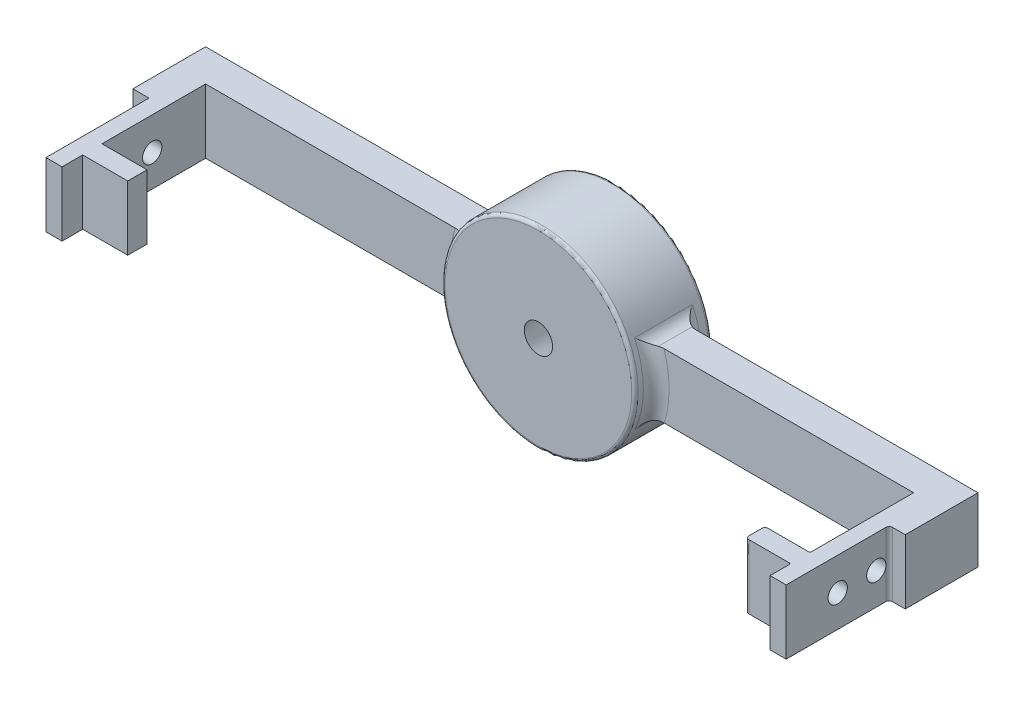
from build123d import *

# Parameters (mm, degrees)
SKETCH7_R            = 15
BOSS_EXTRUDE2_DEPTH  = 12
SKETCH8_R            = 2.2
CUT_EXTRUDE2_DEPTH   = 20
CUT_EXTRUDE2_DRAFT   = 20
BOSS_EXTRUDE4_START  = -3
SKETCH11_W           = 5
SKETCH11_H           = 10
BOSS_EXTRUDE4_DEPTH  = 48
SKETCH14_W           = 5
SKETCH14_H           = 10
BOSS_EXTRUDE5_DEPTH  = 6.3
SKETCH17_W           = 2.5
SKETCH17_H           = 10
BOSS_EXTRUDE8_DEPTH  = 16
SKETCH20_R           = 1.5
CUT_EXTRUDE3_DEPTH   = 15
FILLET2_R            = 2
FILLET7_R            = 0.5
FILLET8_R            = 0.5
SKETCH24_W           = 3
SKETCH24_H           = 10
BOSS_EXTRUDE11_DEPTH = 7
FILLET2_OF_MIRROR5_R = 2
FILLET9_R            = 0.2
FILLET10_START       = -6
FILLET10_DEPTH       = 12
FILLET10_START_2     = -4.929582237
FILLET10_2_DEPTH     = 10
FILLET11_R           = 0.5


with BuildPart() as part:
    # Sketch7 → Boss-Extrude2 (new body)
    with BuildSketch(Plane.XY.offset(37)):
        Circle(SKETCH7_R)
    extrude(amount=-BOSS_EXTRUDE2_DEPTH)


with BuildPart() as cut_extrude2_tool:
    # Sketch8 → Cut-Extrude2 (with draft: the straight prism first)
    with BuildSketch(Plane.XY.offset(37)):
        Circle(SKETCH8_R)
    extrude(amount=-CUT_EXTRUDE2_DEPTH)
    # Cut-Extrude2: the draft: its side faces are tilted about the plane it starts from
    cut_extrude2_sides = [cut_extrude2_tool.faces().sort_by_distance(p)[0] for p in [
        (-2.2, 0, 27),
    ]]
    draft(cut_extrude2_sides, Plane.XY.offset(37), CUT_EXTRUDE2_DRAFT)


with BuildPart() as part_1:
    add(part.part)

    # Cut-Extrude2: cut by cut_extrude2_tool
    add(cut_extrude2_tool.part, mode=Mode.SUBTRACT)

    # Sketch11 → Boss-Extrude4 (add)
    with BuildSketch(Plane(origin=(15, 0, 0), x_dir=(0, 0, -1), z_dir=(1, 0, 0)).offset(BOSS_EXTRUDE4_START)):
        with Locations((-31.203319291, 0.070417763)):
            Rectangle(SKETCH11_W, SKETCH11_H)
    boss_extrude4 = extrude(amount=BOSS_EXTRUDE4_DEPTH)

    # Sketch14 → Boss-Extrude5 (add)
    with BuildSketch(Plane.XY.offset(33.703319291)):
        with Locations((57.5, 0.070417763)):
            Rectangle(SKETCH14_W, SKETCH14_H)
    boss_extrude5 = extrude(amount=BOSS_EXTRUDE5_DEPTH)

    # Sketch17 → Boss-Extrude8 (add)
    with BuildSketch(Plane.XY.offset(40.003319291)):
        with Locations((56.25, 0.070417763)):
            Rectangle(SKETCH17_W, SKETCH17_H)
    boss_extrude8 = extrude(amount=BOSS_EXTRUDE8_DEPTH)

    # Sketch20 → Cut-Extrude3 (cut)
    with BuildSketch(Plane(origin=(57.5, 0, 0), x_dir=(0, 0, -1), z_dir=(1, 0, 0))):
        with Locations((-42.003319291, 0)):
            Circle(SKETCH20_R)
        with Locations((-48.003319291, 0)):
            Circle(SKETCH20_R)
    cut_extrude3 = extrude(amount=-CUT_EXTRUDE3_DEPTH, mode=Mode.SUBTRACT)

    # Fillet2
    fillet2_edges = [part_1.edges().sort_by_distance(p)[0] for p in [
        (14.166835178, -4.929582237, 31.203319291),
        (14.777611852, 2.573361217, 28.703319291),
        (14.117041606, 5.070417763, 31.203319291),
        (14.777611852, 2.573361217, 33.703319291),
    ]]
    fillet(fillet2_edges, radius=FILLET2_R)

    # Fillet7
    fillet7_edges = [part_1.edges().sort_by_distance(p)[0] for p in [
        (-15, 0, 37),
    ]]
    fillet(fillet7_edges, radius=FILLET7_R)

    # Fillet8
    fillet8_edges = [part_1.edges().sort_by_distance(p)[0] for p in [
        (-15, 0, 25),
    ]]
    fillet(fillet8_edges, radius=FILLET8_R)

    # Sketch24 → Boss-Extrude11 (add)
    with BuildSketch(Plane.ZY.offset(-55)):
        with Locations((51.303319291, 0.070417763)):
            Rectangle(SKETCH24_W, SKETCH24_H)
    boss_extrude11 = extrude(amount=BOSS_EXTRUDE11_DEPTH)

    # Mirror5: Boss-Extrude4, Boss-Extrude5, Boss-Extrude8, Cut-Extrude3, Boss-Extrude11 across plane
    add(boss_extrude4.mirror(Plane(origin=(0, 0, 0), x_dir=(0, 0, 1), z_dir=(1, 0, 0))))
    add(boss_extrude5.mirror(Plane(origin=(0, 0, 0), x_dir=(0, 0, 1), z_dir=(1, 0, 0))))
    add(boss_extrude8.mirror(Plane(origin=(0, 0, 0), x_dir=(0, 0, 1), z_dir=(1, 0, 0))))
    add(cut_extrude3.mirror(Plane(origin=(0, 0, 0), x_dir=(0, 0, 1), z_dir=(1, 0, 0))), mode=Mode.SUBTRACT)
    add(boss_extrude11.mirror(Plane(origin=(0, 0, 0), x_dir=(0, 0, 1), z_dir=(1, 0, 0))))

    # Fillet2 of Mirror5
    fillet2_of_mirror5_edges = [part_1.edges().sort_by_distance(p)[0] for p in [
        (-14.166835178, -4.929582237, 31.203319291),
        (-14.777611852, 2.573361217, 28.703319291),
        (-14.117041606, 5.070417763, 31.203319291),
        (-14.777611852, 2.573361217, 33.703319291),
    ]]
    fillet(fillet2_of_mirror5_edges, radius=FILLET2_OF_MIRROR5_R)

    # Fillet9
    fillet9_edges = [part_1.edges().sort_by_distance(p)[0] for p in [
        (55, 0.070417763, 52.803319291),
        (55, 0.070417763, 49.803319291),
    ]]
    fillet(fillet9_edges, radius=FILLET9_R)

    # Fillet10: read off the stored shape, not the designer's step
    # Fillet10 outline → Fillet10 (cut)
    with BuildSketch(Plane(origin=(0, 0, 0), x_dir=(1, 0, 0), z_dir=(0, 1, 0)).offset(FILLET10_START)):
        with BuildLine():
            Line((48, -49.803319291), (48, -50.303319291))
            ThreePointArc((48, -50.303319291), (48.14644661, -49.949765901), (48.5, -49.803319291))
            Line((48.5, -49.803319291), (48, -49.803319291))
        make_face()
    extrude(amount=FILLET10_DEPTH, mode=Mode.SUBTRACT)

    # Fillet10 2 outline → Fillet10 2 (add)
    with BuildSketch(Plane(origin=(0, 0, 0), x_dir=(1, 0, 0), z_dir=(0, 1, 0)).offset(FILLET10_START_2)):
        with BuildLine():
            ThreePointArc((57.5, -40.503319291), (57.64644661, -40.149765901), (58, -40.003319291))
            Line((58, -40.003319291), (57.5, -40.003319291))
            Line((57.5, -40.003319291), (57.5, -40.503319291))
        make_face()
    extrude(amount=FILLET10_2_DEPTH)

    # Fillet11
    fillet11_edges = [part_1.edges().sort_by_distance(p)[0] for p in [
        (48, 0.070417763, 52.803319291),
    ]]
    fillet(fillet11_edges, radius=FILLET11_R)


solid = part_1.part
